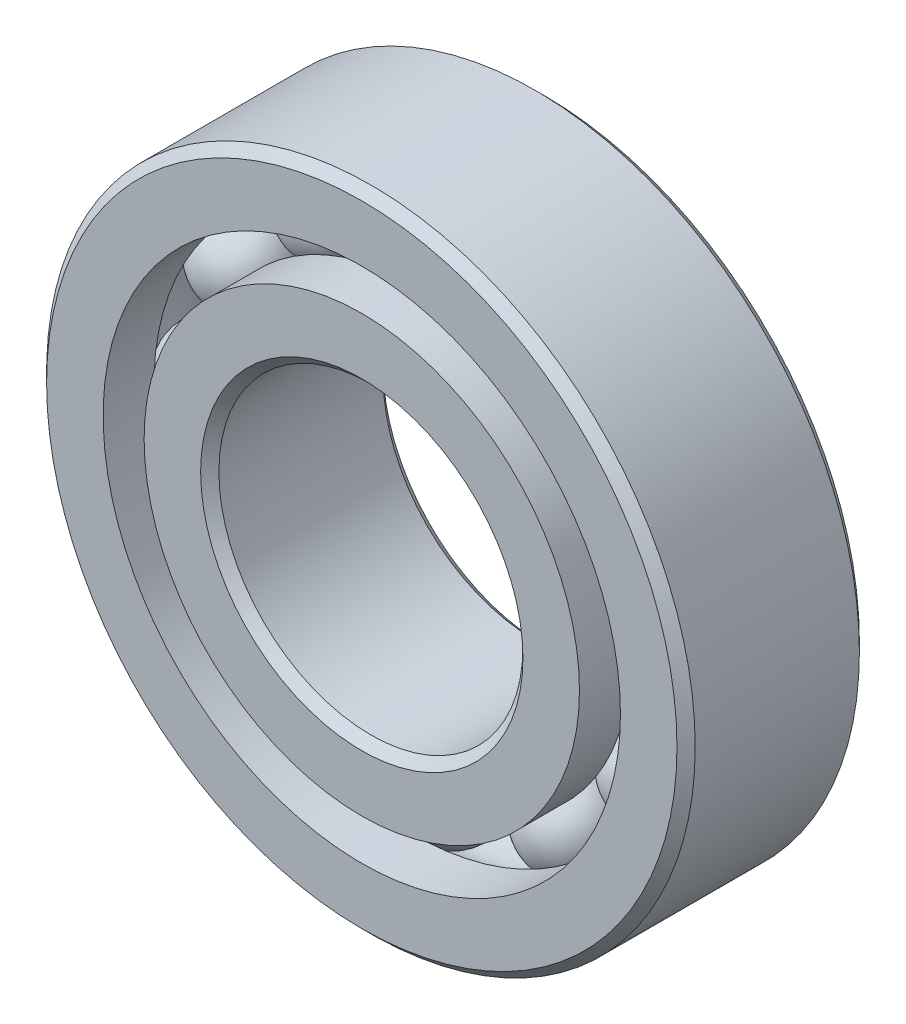
from build123d import *

# Parameters (mm, degrees)
CIRPATTERN1_COUNT = 12


with BuildPart() as part:
    # Sketch1 → Revolve1 (revolve)
    with BuildSketch(Plane(origin=(0, 0, 0), x_dir=(0, 0, -1), z_dir=(1, 0, 0))):
        with BuildLine():
            Line((4.05, 16), (-4.05, 16))
            Line((-4.05, 16), (-4.5, 15.55))
            Line((-4.5, 15.55), (-4.5, 12.760989011))
            Line((-4.5, 12.760989011), (-2, 12.760989011))
            ThreePointArc((-2, 12.760989011), (0, 13.991003967), (2, 12.760989011))
            Line((2, 12.760989011), (4.5, 12.760989011))
            Line((4.5, 12.760989011), (4.5, 15.55))
            Line((4.5, 15.55), (4.05, 16))
        make_face()
    revolve(axis=Axis((0, 0, 4.5), (0, 0, -1)))


with BuildPart() as body_2:
    # Sketch3 → Revolve3 (revolve)
    with BuildSketch(Plane(origin=(0, 0, 0), x_dir=(0, 0, -1), z_dir=(1, 0, 0))):
        with BuildLine():
            Line((-4.5, 10.739010989), (-2, 10.739010989))
            ThreePointArc((-2, 10.739010989), (0, 9.508996033), (2, 10.739010989))
            Line((2, 10.739010989), (4.5, 10.739010989))
            Line((4.5, 10.739010989), (4.5, 7.95))
            Line((4.5, 7.95), (4.05, 7.5))
            Line((4.05, 7.5), (-4.05, 7.5))
            Line((-4.05, 7.5), (-4.5, 7.95))
            Line((-4.5, 7.95), (-4.5, 10.739010989))
        make_face()
    revolve(axis=Axis((0, 0, 4.5), (0, 0, -1)))


with BuildPart() as body_3:
    # Sketch4 → Revolve4 (revolve)
    with BuildSketch(Plane(origin=(0, 0, 0), x_dir=(0, 0, -1), z_dir=(1, 0, 0))):
        with BuildLine():
            Line((-2.241003967, 11.75), (2.241003967, 11.75))
            ThreePointArc((2.241003967, 11.75), (0, 13.991003967), (-2.241003967, 11.75))
        make_face()
    revolve(axis=Axis((0, 11.75, 2.241003967), (0, 0, -1)))


with BuildPart() as cirpattern1_1:
    # CirPattern1: pattern copy
    add(body_3.part.rotate(Axis((0, 0, -4.5), (0, 0, 1)), 1 * 360 / CIRPATTERN1_COUNT))


with BuildPart() as cirpattern1_2:
    # CirPattern1: pattern copy
    add(body_3.part.rotate(Axis((0, 0, -4.5), (0, 0, 1)), 2 * 360 / CIRPATTERN1_COUNT))


with BuildPart() as cirpattern1_3:
    # CirPattern1: pattern copy
    add(body_3.part.rotate(Axis((0, 0, -4.5), (0, 0, 1)), 3 * 360 / CIRPATTERN1_COUNT))


with BuildPart() as cirpattern1_4:
    # CirPattern1: pattern copy
    add(body_3.part.rotate(Axis((0, 0, -4.5), (0, 0, 1)), 4 * 360 / CIRPATTERN1_COUNT))


with BuildPart() as cirpattern1_5:
    # CirPattern1: pattern copy
    add(body_3.part.rotate(Axis((0, 0, -4.5), (0, 0, 1)), 5 * 360 / CIRPATTERN1_COUNT))


with BuildPart() as cirpattern1_6:
    # CirPattern1: pattern copy
    add(body_3.part.rotate(Axis((0, 0, -4.5), (0, 0, 1)), 6 * 360 / CIRPATTERN1_COUNT))


with BuildPart() as cirpattern1_7:
    # CirPattern1: pattern copy
    add(body_3.part.rotate(Axis((0, 0, -4.5), (0, 0, 1)), 7 * 360 / CIRPATTERN1_COUNT))


with BuildPart() as cirpattern1_8:
    # CirPattern1: pattern copy
    add(body_3.part.rotate(Axis((0, 0, -4.5), (0, 0, 1)), 8 * 360 / CIRPATTERN1_COUNT))


with BuildPart() as cirpattern1_9:
    # CirPattern1: pattern copy
    add(body_3.part.rotate(Axis((0, 0, -4.5), (0, 0, 1)), 9 * 360 / CIRPATTERN1_COUNT))


with BuildPart() as cirpattern1_10:
    # CirPattern1: pattern copy
    add(body_3.part.rotate(Axis((0, 0, -4.5), (0, 0, 1)), 10 * 360 / CIRPATTERN1_COUNT))


with BuildPart() as cirpattern1_11:
    # CirPattern1: pattern copy
    add(body_3.part.rotate(Axis((0, 0, -4.5), (0, 0, 1)), 11 * 360 / CIRPATTERN1_COUNT))


solid = Compound([part.part, body_2.part, body_3.part, cirpattern1_1.part, cirpattern1_2.part, cirpattern1_3.part, cirpattern1_4.part, cirpattern1_5.part, cirpattern1_6.part, cirpattern1_7.part, cirpattern1_8.part, cirpattern1_9.part, cirpattern1_10.part, cirpattern1_11.part])
